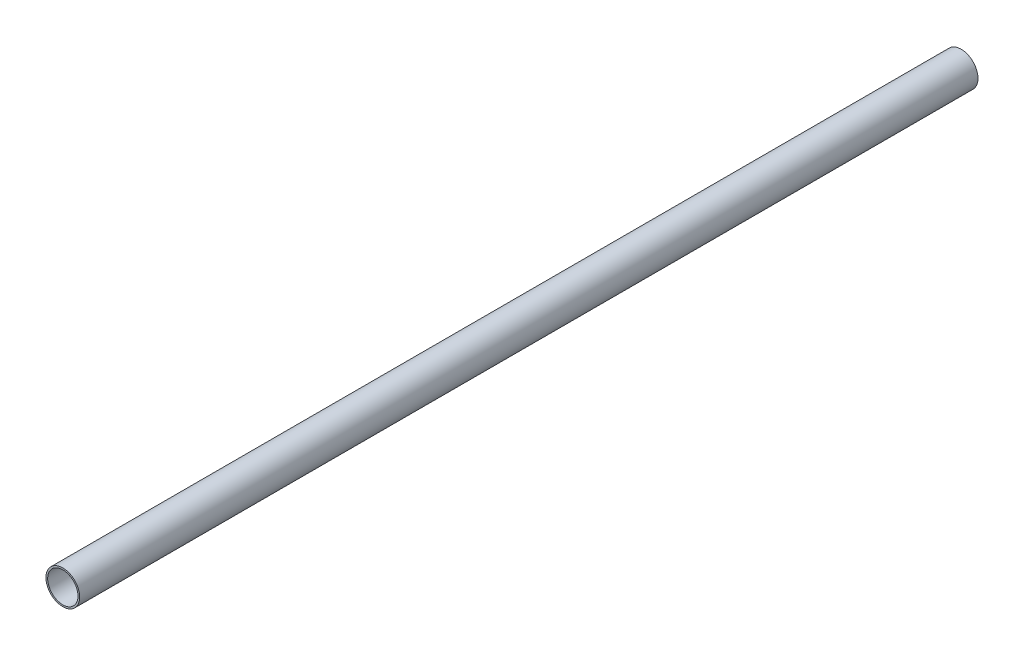
from build123d import *

# Parameters (mm, degrees)
SKETCH1_R           = 15
BOSS_EXTRUDE1_DEPTH = 800
SKETCH2_R           = 13.5
CUT_EXTRUDE1_DEPTH  = 801.281200579


with BuildPart() as part:
    # Sketch1 → Boss-Extrude1 (new body)
    with BuildSketch(Plane.XY):
        Circle(SKETCH1_R)
    extrude(amount=BOSS_EXTRUDE1_DEPTH)

    # Sketch2 → Cut-Extrude1 (cut, through all)
    with BuildSketch(Plane(origin=(0, 0, 0), x_dir=(-1, 0, 0), z_dir=(0, 0, -1))):
        Circle(SKETCH2_R)
    extrude(amount=-CUT_EXTRUDE1_DEPTH, mode=Mode.SUBTRACT)


solid = part.part
